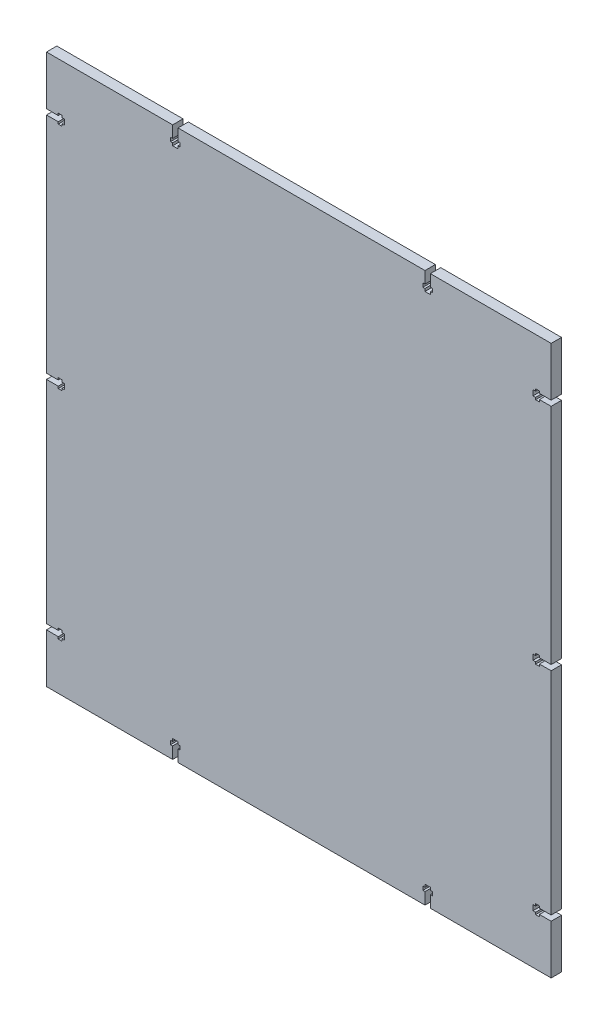
from build123d import *

# Parameters (mm, degrees)
EXTRUDE_1_DEPTH = 6


with BuildPart() as part:
    # Эскиз1 → Бобышка-Вытянуть1 (new body)
    with BuildSketch(Plane.XY):
        Polygon((0, 0), (73, 0), (73, -6.8), (71.8, -6.8), (71.8, -9), (73, -9), (73, -10.5), (76.1, -10.5), (76.1, -9), (77.3, -9), (77.3, -6.8), (76.1, -6.8), (76.1, 0), (219, 0), (219, -6.8), (217.8, -6.8), (217.8, -9), (219, -9), (219, -10.5), (222.1, -10.5), (222.1, -9), (223.3, -9), (223.3, -6.8), (222.1, -6.8), (222.1, 0), (292, 0), (292, -28.45), (285.2, -28.45), (285.2, -27.25), (283, -27.25), (283, -28.45), (281.5, -28.45), (281.5, -31.55), (283, -31.55), (283, -32.75), (285.2, -32.75), (285.2, -31.55), (292, -31.55), (292, -33.1), (292, -160.95), (285.2, -160.95), (285.2, -159.75), (283, -159.75), (283, -160.95), (281.5, -160.95), (281.5, -164.05), (283, -164.05), (283, -165.25), (285.2, -165.25), (285.2, -164.05), (292, -164.05), (292, -286.45), (285.2, -286.45), (285.2, -285.25), (283, -285.25), (283, -286.45), (281.5, -286.45), (281.5, -289.55), (283, -289.55), (283, -290.75), (285.2, -290.75), (285.2, -289.55), (292, -289.55), (292, -318), (222.1, -318), (222.1, -311.2), (223.3, -311.2), (223.3, -309), (222.1, -309), (222.1, -307.5), (219, -307.5), (219, -309), (217.8, -309), (217.8, -311.2), (219, -311.2), (219, -318), (76.1, -318), (76.1, -311.2), (77.3, -311.2), (77.3, -309), (76.1, -309), (76.1, -307.5), (73, -307.5), (73, -309), (71.8, -309), (71.8, -311.2), (73, -311.2), (73, -318), (0, -318), (0, -289.55), (6.8, -289.55), (6.8, -290.75), (9, -290.75), (9, -289.55), (10.5, -289.55), (10.5, -286.45), (9, -286.45), (9, -285.25), (6.8, -285.25), (6.8, -286.45), (0, -286.45), (0, -164.05), (6.8, -164.05), (6.8, -165.25), (9, -165.25), (9, -164.05), (10.5, -164.05), (10.5, -160.95), (9, -160.95), (9, -159.75), (6.8, -159.75), (6.8, -160.95), (0, -160.95), (0, -31.55), (6.8, -31.55), (6.8, -32.75), (9, -32.75), (9, -31.55), (10.5, -31.55), (10.5, -28.45), (9, -28.45), (9, -27.25), (6.8, -27.25), (6.8, -28.45), (0, -28.45), align=None)
    extrude(amount=EXTRUDE_1_DEPTH)


solid = part.part
